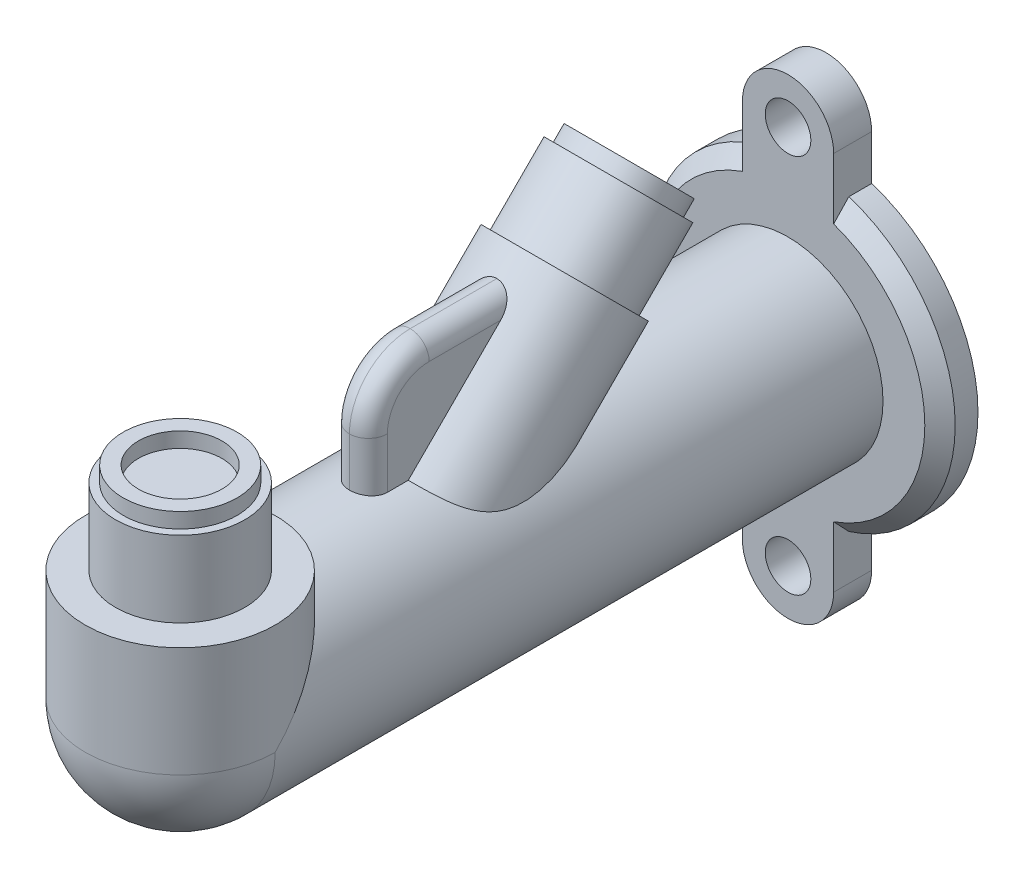
from build123d import *

# Parameters (mm, degrees)
SZKIC1_R                         = 3
DODANIE_WYCI_GNI_CIE1_DEPTH      = 5
SFAZOWANIE1_SIZE                 = 2
SZKIC2_R                         = 12.5
DODANIE_WYCI_GNI_CIE2_DEPTH      = 80
DODANIE_WYCI_GNI_CIE3_DEPTH      = 15
DODANIE_WYCI_GNI_CIE3_DEPTH_BACK = 10
SZKIC5_R                         = 9
SZKIC6_R                         = 8
DODANIE_WYCI_GNI_CIE4_DEPTH      = 10
SZKIC7_R                         = 7
SZKIC7_R_2                       = 5
DODANIE_WYCI_GNI_CIE5_DEPTH      = 2
EBRO1_START                      = -2.5
EBRO1_DEPTH                      = 5
ZAOKR_GLENIE1_R                  = 2.5
DODANIE_WYCI_GNI_CIE6_DEPTH      = 2
DODANIE_WYCI_GNI_CIE6_DEPTH_BACK = 12.5
SZKIC9_R                         = 12.5
OBR_T1_ANGLE                     = 90
SZKIC11_R                        = 8.5
DODANIE_WYCI_GNI_CIE7_DEPTH      = 10
SZKIC12_R                        = 7.5
SZKIC12_R_2                      = 5.5
DODANIE_WYCI_GNI_CIE8_DEPTH      = 2


# Read off the part's stored shape, not the designer's step: Żebro1
with BuildPart() as part:
    # Szkic1 → Dodanie-wyciągnięcie1 (new body)
    with BuildSketch(Plane.XY):
        with BuildLine():
            Line((6, 19.078784028), (6, 25))
            ThreePointArc((6, 25), (0, 31), (-6, 25))
            Line((-6, 25), (-6, 19.078784028))
            ThreePointArc((-6, 19.078784028), (-20, 0), (-6, -19.078784028))
            Line((-6, -19.078784028), (-6, -25))
            ThreePointArc((-6, -25), (0, -31), (6, -25))
            Line((6, -25), (6, -19.078784028))
            ThreePointArc((6, -19.078784028), (20, 0), (6, 19.078784028))
        make_face()
        with Locations((0, 25)):
            Circle(SZKIC1_R, mode=Mode.SUBTRACT)
        with Locations((0, -25)):
            Circle(SZKIC1_R, mode=Mode.SUBTRACT)
    extrude(amount=DODANIE_WYCI_GNI_CIE1_DEPTH)

    # Sfazowanie1
    sfazowanie1_edges = [part.edges().sort_by_distance(p)[0] for p in [
        (20, 0, 5),
        (-20, 0, 5),
    ]]
    chamfer(sfazowanie1_edges, length=SFAZOWANIE1_SIZE)

    # Szkic2 → Dodanie-wyciągnięcie2 (add)
    with BuildSketch(Plane.XY.offset(5)):
        Circle(SZKIC2_R)
    extrude(amount=DODANIE_WYCI_GNI_CIE2_DEPTH)

    # Szkic5 → Dodanie-wyciągnięcie3 (add, two sides: drawn at the far end of the back side and taken through both)
    with BuildSketch(Plane(origin=(0, 12.5, 45), x_dir=(1, 0, 0), z_dir=(0, 0.7071067811865437, -0.7071067811865515)).offset(-DODANIE_WYCI_GNI_CIE3_DEPTH_BACK)):
        with Locations(Location((0, 0, 0), (0, 0, 270))):
            Circle(SZKIC5_R)
    extrude(amount=DODANIE_WYCI_GNI_CIE3_DEPTH + DODANIE_WYCI_GNI_CIE3_DEPTH_BACK)

    # Szkic6 → Dodanie-wyciągnięcie4 (add)
    with BuildSketch(Plane(origin=(0, -5.643398282, 5.643398282), x_dir=(1, 0, 0), z_dir=(0, 0.7071067811865437, -0.7071067811865513))):
        with Locations(Location((0, -40.658639918, 0), (0, 0, 270))):
            Circle(SZKIC6_R)
    extrude(amount=DODANIE_WYCI_GNI_CIE4_DEPTH)

    # Szkic7 → Dodanie-wyciągnięcie5 (add)
    with BuildSketch(Plane(origin=(0, 1.42766953, -1.42766953), x_dir=(1, 0, 0), z_dir=(0, 0.7071067811865437, -0.7071067811865515))):
        with Locations(Location((0, -40.658639918, 0), (0, 0, 270))):
            Circle(SZKIC7_R)
        with Locations(Location((0, -40.658639918, 0), (0, 0, 270))):
            Circle(SZKIC7_R_2, mode=Mode.SUBTRACT)
    extrude(amount=DODANIE_WYCI_GNI_CIE5_DEPTH)

    # Żebro1 outline → Żebro1 (add)
    with BuildSketch(Plane(origin=(0, 0, 0), x_dir=(0, 0, -1), z_dir=(1, 0, 0)).offset(EBRO1_START)):
        with BuildLine():
            Line((-62.727922061, 18.909453225), (-62.727922061, 12))
            Line((-62.727922061, 12), (-42, 12))
            Line((-42, 12), (-42, 26.909453225))
            Line((-42, 26.909453225), (-54.727922061, 26.909453225))
            ThreePointArc((-54.727922061, 26.909453225), (-60.384776311, 24.566307475), (-62.727922061, 18.909453225))
        make_face()
    extrude(amount=EBRO1_DEPTH)

    # Zaokrąglenie1
    zaokr_glenie1_edges = [part.edges().sort_by_distance(p)[0] for p in [
        (-2.5, 15.578450969, 62.727922061),
        (-2.5, 26.909453225, 48.772744048),
        (2.5, 15.578450969, 62.727922061),
        (2.5, 24.566307475, 60.384776311),
        (-2.5, 24.566307475, 60.384776311),
        (2.5, 26.909453225, 48.772744048),
    ]]
    fillet(zaokr_glenie1_edges, radius=ZAOKR_GLENIE1_R - 0.0001)  # a hair under: the kernel refuses the full size

    # Szkic9 → Dodanie-wyciągnięcie6 (add, two sides: drawn at the far end of the back side and taken through both)
    with BuildSketch(Plane(origin=(0, 12.5, 0), x_dir=(1, 0, 0), z_dir=(0, 1, 0)).offset(-DODANIE_WYCI_GNI_CIE6_DEPTH_BACK)):
        with Locations(Location((0, -85, 0), (0, 0, 270))):
            Circle(SZKIC9_R)
    extrude(amount=DODANIE_WYCI_GNI_CIE6_DEPTH + DODANIE_WYCI_GNI_CIE6_DEPTH_BACK)

    # Szkic10 → Obrót1 (revolve)
    with BuildSketch(Plane.XY.offset(85)):
        with BuildLine():
            Line((-12.5, 0), (12.5, 0))
            ThreePointArc((12.5, 0), (0, -12.5), (-12.5, 0))
        make_face()
    revolve(axis=Axis((-12.5, 0, 85), (-1, 0, 0)), revolution_arc=OBR_T1_ANGLE)

    # Szkic11 → Dodanie-wyciągnięcie7 (add)
    with BuildSketch(Plane(origin=(0, 14.5, 0), x_dir=(1, 0, 0), z_dir=(0, 1, 0))):
        with Locations(Location((0, -85, 0), (0, 0, 270))):
            Circle(SZKIC11_R)
    extrude(amount=DODANIE_WYCI_GNI_CIE7_DEPTH)

    # Szkic12 → Dodanie-wyciągnięcie8 (add)
    with BuildSketch(Plane(origin=(0, 24.5, 0), x_dir=(1, 0, 0), z_dir=(0, 1, 0))):
        with Locations(Location((0, -85, 0), (0, 0, 270))):
            Circle(SZKIC12_R)
        with Locations(Location((0, -85, 0), (0, 0, 270))):
            Circle(SZKIC12_R_2, mode=Mode.SUBTRACT)
    extrude(amount=DODANIE_WYCI_GNI_CIE8_DEPTH)


solid = part.part
